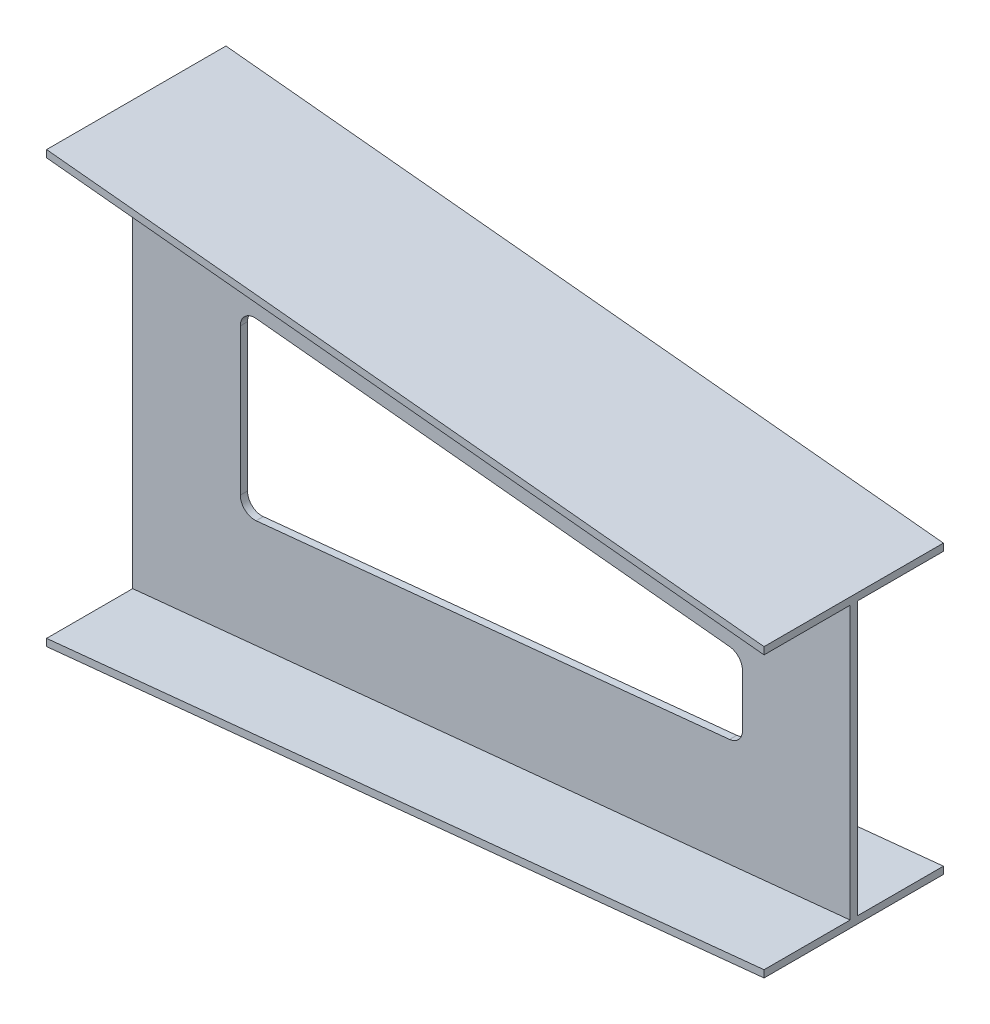
from build123d import *

# Parameters (mm, degrees)
CUT_EXTRUDE1_DEPTH = 10


with BuildPart() as part:
    # Sketch1 → Loft4 section 0
    with BuildSketch(Plane(origin=(0, 0, 0), x_dir=(0, 0, -1), z_dir=(1, 0, 0))):
        with BuildLine():
            Line((-130, 300), (120, 300))
            Line((120, 300), (120, 290))
            Line((120, 290), (0, 290))
            Line((0, 290), (0, -290))
            Line((0, -290), (120, -290))
            Line((120, -290), (120, -300))
            Line((120, -300), (-130, -300))
            Line((-130, -300), (-130, -290))
            Line((-130, -290), (-10, -290))
            Line((-10, -290), (-10, 290))
            Line((-10, 290), (-130, 290))
            Line((-130, 290), (-130, 300))
        make_face()
    # Sketch4 → Loft4 section 1
    with BuildSketch(Plane(origin=(1000, 0, -1000), x_dir=(0, 0, 1), z_dir=(-1, 0, 0))):
        with BuildLine():
            Line((880, 200), (1130, 200))
            Line((1130, 200), (1130, 190))
            Line((1130, 190), (1010, 190))
            Line((1010, 190), (1010, -190))
            Line((1010, -190), (1130, -190))
            Line((1130, -190), (1130, -200))
            Line((1130, -200), (880, -200))
            Line((880, -200), (880, -190))
            Line((880, -190), (1000, -190))
            Line((1000, -190), (1000, 190))
            Line((1000, 190), (880, 190))
            Line((880, 190), (880, 200))
        make_face()
    loft()

    # Sketch6 → Cut-Extrude1 (cut)
    with BuildSketch(Plane.XY.offset(10)):
        with BuildLine():
            Line((171.99007438, -122.052858245), (831.99007438, -56.052858245))
            ThreePointArc((831.99007438, -56.052858245), (844.829050671, -49.572220856), (850, -36.152114441))
            Line((850, -36.152114441), (850, 36.152114441))
            ThreePointArc((850, 36.152114441), (844.829050671, 49.572220856), (831.99007438, 56.052858245))
            Line((831.99007438, 56.052858245), (171.99007438, 122.052858245))
            ThreePointArc((171.99007438, 122.052858245), (156.579893585, 116.981165112), (150, 102.152114441))
            Line((150, 102.152114441), (150, -102.152114441))
            ThreePointArc((150, -102.152114441), (156.579893585, -116.981165112), (171.99007438, -122.052858245))
        make_face()
    extrude(amount=-CUT_EXTRUDE1_DEPTH, mode=Mode.SUBTRACT)


solid = part.part
